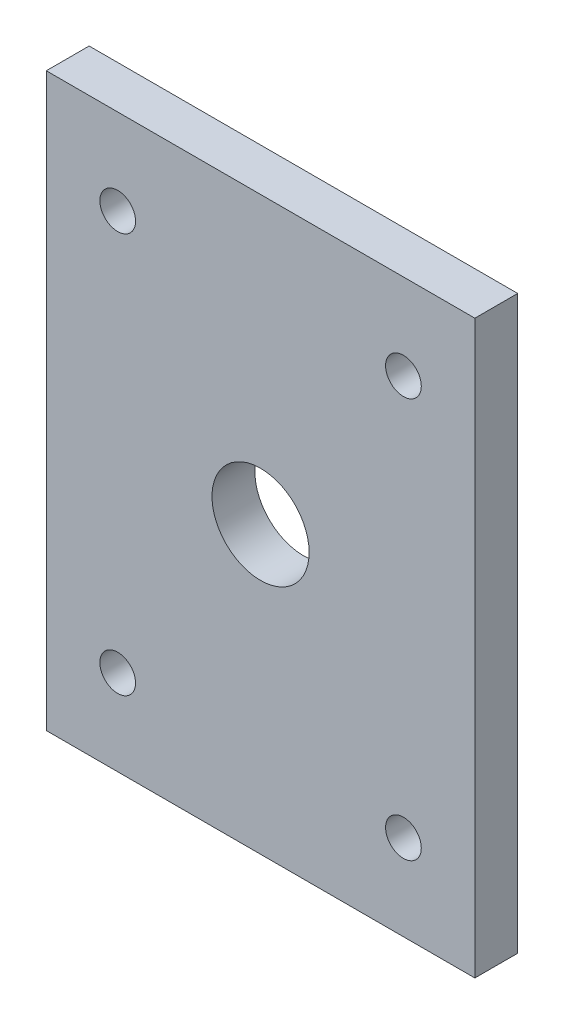
from build123d import *

# Parameters (mm, degrees)
SKETCH1_W                       = 30
SKETCH1_H                       = 40
BOSS_EXTRUDE1_DEPTH             = 3
TAP_DRILL_FOR_M3_TAP1_OUTLINE_R = 1.25
TAP_DRILL_FOR_M3_TAP1_DEPTH     = 3
TAP_DRILL_FOR_M8_TAP1_D         = 6.8
TAP_DRILL_FOR_M8_TAP1_DEPTH     = 3


# Read off the part's stored shape, not the designer's step: Tap Drill for M3 Tap1
with BuildPart() as part:
    # Sketch1 → Boss-Extrude1 (new body)
    with BuildSketch(Plane.XY):
        with Locations((15, 20)):
            Rectangle(SKETCH1_W, SKETCH1_H)
    extrude(amount=BOSS_EXTRUDE1_DEPTH)

    # Tap Drill for M3 Tap1 outline → Tap Drill for M3 Tap1 (cut)
    with BuildSketch(Plane.XY):
        with Locations((25, 6)):
            Circle(TAP_DRILL_FOR_M3_TAP1_OUTLINE_R)
        with Locations((5, 34)):
            Circle(TAP_DRILL_FOR_M3_TAP1_OUTLINE_R)
        with Locations((5, 6)):
            Circle(TAP_DRILL_FOR_M3_TAP1_OUTLINE_R)
        with Locations((25, 34)):
            Circle(TAP_DRILL_FOR_M3_TAP1_OUTLINE_R)
        with Locations((15, 20)):
            Circle(TAP_DRILL_FOR_M3_TAP1_OUTLINE_R)
    extrude(amount=TAP_DRILL_FOR_M3_TAP1_DEPTH, mode=Mode.SUBTRACT)

    # Tap Drill for M8 Tap1
    with Locations(Plane.XY.offset(3)):
        with Locations((15, 20)):
            Hole(TAP_DRILL_FOR_M8_TAP1_D / 2, depth=TAP_DRILL_FOR_M8_TAP1_DEPTH)


solid = part.part
